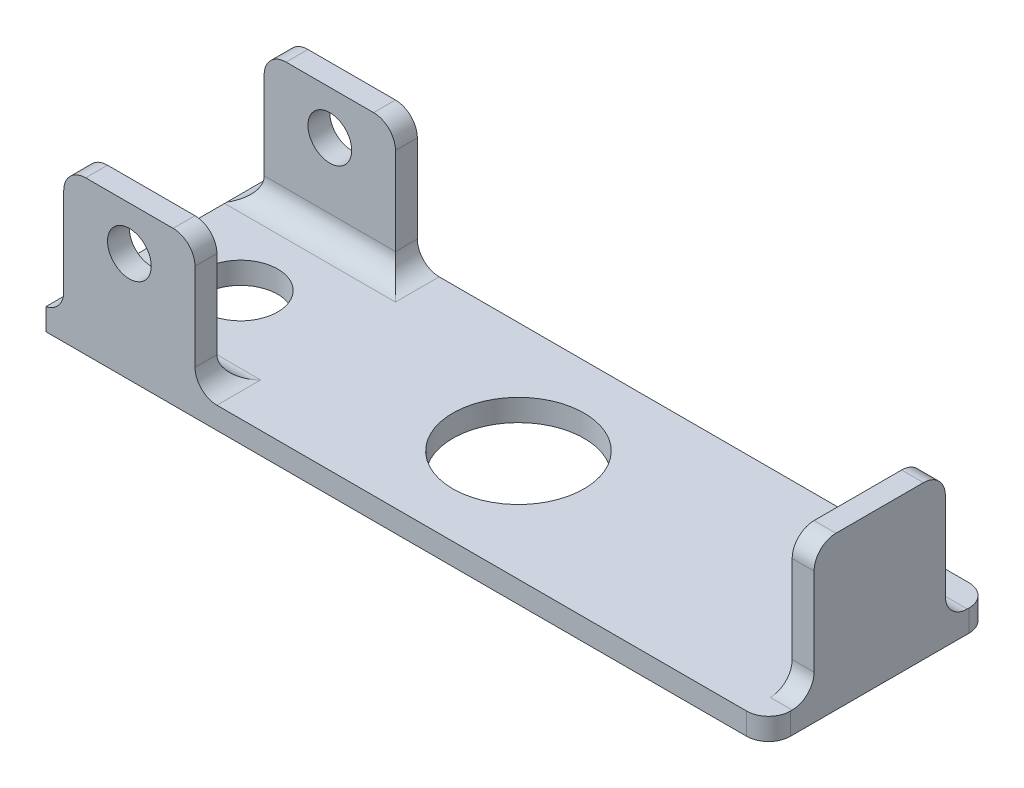
from build123d import *

# Parameters (mm, degrees)
SKETCH1_W                = 33.02
SKETCH1_H                = 10.16
SKETCH1_R                = 3
SKETCH1_R_2              = 1.7
BOSS_EXTRUDE1_DEPTH      = 1
SKETCH2_W                = 6
SKETCH2_H                = 1
SKETCH2_W_2              = 1
SKETCH2_H_2              = 6
BOSS_EXTRUDE2_DEPTH      = 6
SKETCH3_R                = 1
CUT_EXTRUDE1_DEPTH       = 21.610815122
FILLET1_R                = 1
BOSS_EXTRUDE3_DEPTH      = 1
BOSS_EXTRUDE3_DEPTH_BACK = 1


with BuildPart() as part:
    # Sketch1 → Boss-Extrude1 (new body)
    with BuildSketch(Plane(origin=(0, 0, 0), x_dir=(1, 0, 0), z_dir=(0, 1, 0))):
        Rectangle(SKETCH1_W, SKETCH1_H)
        with Locations(Location((0, 0, 0), (0, 0, 270))):
            Circle(SKETCH1_R, mode=Mode.SUBTRACT)
        with Locations(Location((-12.7, 0, 0), (0, 0, 270))):
            Circle(SKETCH1_R_2, mode=Mode.SUBTRACT)
    extrude(amount=BOSS_EXTRUDE1_DEPTH)

    # Sketch2 → Boss-Extrude2 (add)
    with BuildSketch(Plane(origin=(0, 1, 0), x_dir=(1, 0, 0), z_dir=(0, 1, 0))):
        with Locations((-12.7, 4.58)):
            Rectangle(SKETCH2_W, SKETCH2_H)
        with Locations((-12.7, -4.58)):
            Rectangle(SKETCH2_W, SKETCH2_H)
        with Locations((16.01, 0)):
            Rectangle(SKETCH2_W_2, SKETCH2_H_2)
    extrude(amount=BOSS_EXTRUDE2_DEPTH)

    # Sketch3 → Cut-Extrude1 (cut, through all)
    with BuildSketch(Plane.XY.offset(5.08)):
        with Locations((-12.7, 5)):
            Circle(SKETCH3_R)
    extrude(amount=-CUT_EXTRUDE1_DEPTH, mode=Mode.SUBTRACT)

    # Fillet1
    # the kernel refuses this fillet: 1 mm, written as the material it adds along each edge
    with BuildSketch(Plane(origin=(-15.7, 1, -4.08), x_dir=(-1, 0, 0), z_dir=(0, 0, -1))) as fillet1_piece_1:
        with BuildLine():
            CenterArc((1, 0.98178409), FILLET1_R, 180, 79.047215801)
            Line((0, 0.98178409), (0, 0))
            Line((0, 0), (0.81, 0))
        make_face()
    extrude(amount=1)
    with BuildSketch(Plane(origin=(-9.7, 1, -4.08), x_dir=(0, 0, 1), z_dir=(-1, 0, 0))) as fillet1_piece_2:
        with BuildLine():
            CenterArc((FILLET1_R, FILLET1_R), FILLET1_R, 180, 90)
            Line((0, FILLET1_R), (0, 0))
            Line((0, 0), (FILLET1_R, 0))
        make_face()
    extrude(amount=6)
    with BuildSketch(Plane(origin=(-9.7, 1, -5.08), x_dir=(1, 0, 0), z_dir=(0, 0, 1))) as fillet1_piece_3:
        with BuildLine():
            CenterArc((FILLET1_R, FILLET1_R), FILLET1_R, 180, 90)
            Line((0, FILLET1_R), (0, 0))
            Line((0, 0), (FILLET1_R, 0))
        make_face()
    extrude(amount=1)
    with BuildSketch(Plane(origin=(16.51, 1, -3), x_dir=(0, 0, -1), z_dir=(-1, 0, 0)), Plane(origin=(15.51, 1, 3), x_dir=(0, 0, 1), z_dir=(1, 0, 0)), Plane(origin=(-9.7, 1, 5.08), x_dir=(1, 0, 0), z_dir=(0, 0, -1))) as fillet1_piece_4:
        with BuildLine():
            CenterArc((FILLET1_R, -FILLET1_R), FILLET1_R, 90, 90)
            Line((0, -FILLET1_R), (0, 0))
            Line((0, 0), (FILLET1_R, 0))
        make_face()
    extrude(amount=1)
    with BuildSketch(Plane(origin=(-15.7, 1, 4.08), x_dir=(-1, 0, 0), z_dir=(0, 0, 1))) as fillet1_piece_5:
        with BuildLine():
            CenterArc((1, -0.98178409), FILLET1_R, 100.952784199, 79.047215801)
            Line((0, -0.98178409), (0, 0))
            Line((0, 0), (0.81, 0))
        make_face()
    extrude(amount=1)
    with BuildSketch(Plane(origin=(-9.7, 1, 4.08), x_dir=(0, 0, -1), z_dir=(-1, 0, 0))) as fillet1_piece_6:
        with BuildLine():
            CenterArc((FILLET1_R, -FILLET1_R), FILLET1_R, 90, 90)
            Line((0, -FILLET1_R), (0, 0))
            Line((0, 0), (FILLET1_R, 0))
        make_face()
    extrude(amount=6)
    with BuildSketch(Plane(origin=(-15.7, 1, -1.625539774), x_dir=(-1, 0, 0), z_dir=(0, 0, -1))) as fillet1_piece_7a_section:
        with BuildLine():
            CenterArc((1, 0.98178409), FILLET1_R, 180, 79.047215801)
            Line((0, 0.98178409), (0, 0))
            Line((0, 0), (0.81, 0))
        make_face()
    fillet1_piece_7a = extrude(amount=3.454460226, mode=Mode.PRIVATE)
    fillet1_piece_7a = split(fillet1_piece_7a, bisect_by=Plane(origin=(-15.7, 1, -4.08), z_dir=(0, 0, 1)), keep=Keep.TOP, mode=Mode.PRIVATE)
    with BuildSketch(Plane(origin=(-9.7, 1, -4.08), x_dir=(0, 0, 1), z_dir=(-1, 0, 0))) as fillet1_piece_7b_section:
        with BuildLine():
            CenterArc((FILLET1_R, FILLET1_R), FILLET1_R, 180, 90)
            Line((0, FILLET1_R), (0, 0))
            Line((0, 0), (FILLET1_R, 0))
        make_face()
    fillet1_piece_7b = extrude(amount=8.5, mode=Mode.PRIVATE)
    fillet1_piece_7b = split(fillet1_piece_7b, bisect_by=Plane(origin=(-16.51, 1, -4.08), z_dir=(1, 0, 0)), keep=Keep.TOP, mode=Mode.PRIVATE)
    fillet1_piece_7b = split(fillet1_piece_7b, bisect_by=Plane(origin=(-15.7, 1, -4.08), z_dir=(-1, 0, 0)), keep=Keep.TOP, mode=Mode.PRIVATE)
    fillet1_piece_7 = fillet1_piece_7a & fillet1_piece_7b
    add(fillet1_piece_7)
    with BuildSketch(Plane(origin=(-7.2, 1, -4.08), x_dir=(0, 0, 1), z_dir=(-1, 0, 0))) as fillet1_piece_8a_section:
        with BuildLine():
            CenterArc((FILLET1_R, FILLET1_R), FILLET1_R, 180, 90)
            Line((0, FILLET1_R), (0, 0))
            Line((0, 0), (FILLET1_R, 0))
        make_face()
    fillet1_piece_8a = extrude(amount=8.5, mode=Mode.PRIVATE)
    fillet1_piece_8a = split(fillet1_piece_8a, bisect_by=Plane(origin=(-9.7, 1, -4.08), z_dir=(1, 0, 0)), keep=Keep.TOP, mode=Mode.PRIVATE)
    with BuildSketch(Plane(origin=(-9.7, 1, -5.08), x_dir=(1, 0, 0), z_dir=(0, 0, 1))) as fillet1_piece_8b_section:
        with BuildLine():
            CenterArc((FILLET1_R, FILLET1_R), FILLET1_R, 180, 90)
            Line((0, FILLET1_R), (0, 0))
            Line((0, 0), (FILLET1_R, 0))
        make_face()
    fillet1_piece_8b = extrude(amount=3.5, mode=Mode.PRIVATE)
    fillet1_piece_8b = split(fillet1_piece_8b, bisect_by=Plane(origin=(-9.7, 1, -4.08), z_dir=(0, 0, 1)), keep=Keep.TOP, mode=Mode.PRIVATE)
    fillet1_piece_8 = fillet1_piece_8a & fillet1_piece_8b
    add(fillet1_piece_8)
    with BuildSketch(Plane(origin=(-9.7, 1, 4.08), x_dir=(0, 0, -1), z_dir=(-1, 0, 0))) as fillet1_piece_9a_section:
        with BuildLine():
            CenterArc((FILLET1_R, -FILLET1_R), FILLET1_R, 90, 90)
            Line((0, -FILLET1_R), (0, 0))
            Line((0, 0), (FILLET1_R, 0))
        make_face()
    fillet1_piece_9a = extrude(amount=8.5, mode=Mode.PRIVATE)
    fillet1_piece_9a = split(fillet1_piece_9a, bisect_by=Plane(origin=(-16.51, 1, 4.08), z_dir=(1, 0, 0)), keep=Keep.TOP, mode=Mode.PRIVATE)
    fillet1_piece_9a = split(fillet1_piece_9a, bisect_by=Plane(origin=(-15.7, 1, 4.08), z_dir=(-1, 0, 0)), keep=Keep.TOP, mode=Mode.PRIVATE)
    with BuildSketch(Plane(origin=(-15.7, 1, 1.625539774), x_dir=(-1, 0, 0), z_dir=(0, 0, 1))) as fillet1_piece_9b_section:
        with BuildLine():
            CenterArc((1, -0.98178409), FILLET1_R, 100.952784199, 79.047215801)
            Line((0, -0.98178409), (0, 0))
            Line((0, 0), (0.81, 0))
        make_face()
    fillet1_piece_9b = extrude(amount=3.454460226, mode=Mode.PRIVATE)
    fillet1_piece_9b = split(fillet1_piece_9b, bisect_by=Plane(origin=(-15.7, 1, 4.08), z_dir=(0, 0, -1)), keep=Keep.TOP, mode=Mode.PRIVATE)
    fillet1_piece_9 = fillet1_piece_9a & fillet1_piece_9b
    add(fillet1_piece_9)
    with BuildSketch(Plane(origin=(-9.7, 1, 5.08), x_dir=(1, 0, 0), z_dir=(0, 0, -1))) as fillet1_piece_10a_section:
        with BuildLine():
            CenterArc((FILLET1_R, -FILLET1_R), FILLET1_R, 90, 90)
            Line((0, -FILLET1_R), (0, 0))
            Line((0, 0), (FILLET1_R, 0))
        make_face()
    fillet1_piece_10a = extrude(amount=3.5, mode=Mode.PRIVATE)
    fillet1_piece_10a = split(fillet1_piece_10a, bisect_by=Plane(origin=(-9.7, 1, 4.08), z_dir=(0, 0, -1)), keep=Keep.TOP, mode=Mode.PRIVATE)
    with BuildSketch(Plane(origin=(-7.2, 1, 4.08), x_dir=(0, 0, -1), z_dir=(-1, 0, 0))) as fillet1_piece_10b_section:
        with BuildLine():
            CenterArc((FILLET1_R, -FILLET1_R), FILLET1_R, 90, 90)
            Line((0, -FILLET1_R), (0, 0))
            Line((0, 0), (FILLET1_R, 0))
        make_face()
    fillet1_piece_10b = extrude(amount=8.5, mode=Mode.PRIVATE)
    fillet1_piece_10b = split(fillet1_piece_10b, bisect_by=Plane(origin=(-9.7, 1, 4.08), z_dir=(1, 0, 0)), keep=Keep.TOP, mode=Mode.PRIVATE)
    fillet1_piece_10 = fillet1_piece_10a & fillet1_piece_10b
    add(fillet1_piece_10)
    # the kernel refuses this fillet: 1 mm, written as the material it takes off along each edge
    with BuildSketch(Plane(origin=(-15.7, 7, -1.58), x_dir=(0, -1, 0), z_dir=(0, 0, -1)), Plane(origin=(13.01, 7, 3), x_dir=(0, 0, -1), z_dir=(1, 0, 0)), Plane(origin=(-15.7, 7, 1.58), x_dir=(1, 0, 0), z_dir=(0, 0, 1)), Plane(origin=(16.51, -2.5, 5.08), x_dir=(-1, 0, 0), z_dir=(0, 1, 0))) as fillet1_2_piece_1:
        with BuildLine():
            CenterArc((FILLET1_R, -FILLET1_R), FILLET1_R, 90, 90)
            Line((0, -FILLET1_R), (0, 0))
            Line((0, 0), (FILLET1_R, 0))
        make_face()
    extrude(amount=6, mode=Mode.SUBTRACT)
    with BuildSketch(Plane(origin=(-9.7, 7, -7.58), x_dir=(-1, 0, 0), z_dir=(0, 0, 1)), Plane(origin=(19.01, 7, -3), x_dir=(0, -1, 0), z_dir=(-1, 0, 0)), Plane(origin=(-9.7, 7, 7.58), x_dir=(0, -1, 0), z_dir=(0, 0, -1)), Plane(origin=(16.51, -2.5, -5.08), x_dir=(-1, 0, 0), z_dir=(0, 1, 0))) as fillet1_2_piece_2:
        with BuildLine():
            CenterArc((FILLET1_R, FILLET1_R), FILLET1_R, 180, 90)
            Line((0, FILLET1_R), (0, 0))
            Line((0, 0), (FILLET1_R, 0))
        make_face()
    extrude(amount=6, mode=Mode.SUBTRACT)

    # Sketch4 → Boss-Extrude3 (add, two sides: drawn at the far end of the back side and taken through both)
    with BuildSketch(Plane.XY.offset(-BOSS_EXTRUDE3_DEPTH_BACK)):
        Polygon((14.51, 5), (15.51, 6), (15.51, 4.5), (14.51, 4.5), align=None)
    extrude(amount=BOSS_EXTRUDE3_DEPTH + BOSS_EXTRUDE3_DEPTH_BACK)


solid = part.part
